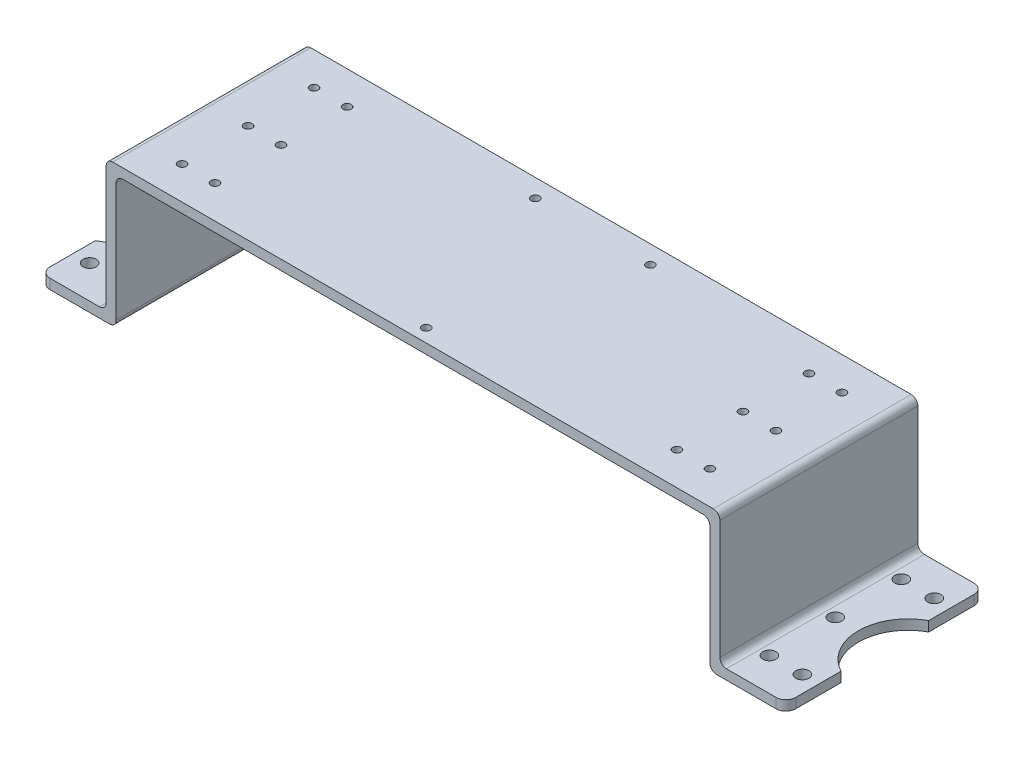
from build123d import *

# Parameters (mm, degrees)
SKETCH_1_W                  = 186
SKETCH_1_H                  = 60
EXTRUDE_1_DEPTH             = 3
SKETCH_2_W                  = 3
SKETCH_2_H                  = 60
EXTRUDE_2_DEPTH             = 40
SKETCH_3_W                  = 60
SKETCH_3_H                  = 3
EXTRUDE_3_DEPTH             = 20
SKETCH_4_R                  = 2
CUT_EXTRUDE_1_DEPTH         = 124.567795157
PATTERN_LINEAR_1_COUNT      = 3
PATTERN_LINEAR_1_PITCH      = 20
PATTERN_LINEAR_1_COUNT_DIR2 = 2
PATTERN_LINEAR_1_PITCH_DIR2 = 10
MIRROR_4_COPY_1_SKETCH_R    = 2
MIRROR_4_COPY_1_DEPTH       = 124.567795157
MIRROR_4_COPY_2_SKETCH_R    = 2
MIRROR_4_COPY_2_DEPTH       = 124.567795157
MIRROR_4_COPY_3_SKETCH_R    = 2
MIRROR_4_COPY_3_DEPTH       = 124.567795157
MIRROR_4_COPY_4_SKETCH_R    = 2
MIRROR_4_COPY_4_DEPTH       = 124.567795157
MIRROR_4_COPY_5_SKETCH_R    = 2
MIRROR_4_COPY_5_DEPTH       = 124.567795157
MIRROR_4_COPY_6_SKETCH_R    = 2
MIRROR_4_COPY_6_DEPTH       = 124.567795157
SKETCH_5_R                  = 1
CUT_EXTRUDE_2_DEPTH         = 3
SKETCH_6_R                  = 1
CUT_EXTRUDE_3_DEPTH         = 3
SKETCH_7_R                  = 1
CUT_EXTRUDE_4_DEPTH         = 3
PATTERN_LINEAR_2_COUNT      = 3
PATTERN_LINEAR_2_PITCH      = 20
PATTERN_LINEAR_2_COUNT_DIR2 = 2
PATTERN_LINEAR_2_PITCH_DIR2 = 10
MIRROR_6_COPY_1_SKETCH_R    = 1
MIRROR_6_COPY_1_DEPTH       = 3
MIRROR_6_COPY_2_SKETCH_R    = 1
MIRROR_6_COPY_2_DEPTH       = 3
MIRROR_6_COPY_3_SKETCH_R    = 1
MIRROR_6_COPY_3_DEPTH       = 3
MIRROR_6_COPY_4_SKETCH_R    = 1
MIRROR_6_COPY_4_DEPTH       = 3
MIRROR_6_COPY_5_SKETCH_R    = 1
MIRROR_6_COPY_5_DEPTH       = 3
MIRROR_6_COPY_6_SKETCH_R    = 1
MIRROR_6_COPY_6_DEPTH       = 3
HOLE_WIZARD_M3_1_D          = 2.5
HOLE_WIZARD_M3_2_D          = 2.5
SKETCH_12_R                 = 15
CUT_EXTRUDE_5_DEPTH         = 124.567795157
FILLET_2_R                  = 2
FILLET_3_R                  = 2
FILLET_4_R                  = 2
FILLET_5_R                  = 3


with BuildPart() as part:
    # 草图1 → 凸台-拉伸1 (new body)
    with BuildSketch(Plane(origin=(0, 0, 0), x_dir=(1, 0, 0), z_dir=(0, 1, 0))):
        Rectangle(SKETCH_1_W, SKETCH_1_H)
    extrude(amount=EXTRUDE_1_DEPTH)

    # 草图2 → 凸台-拉伸2 (add)
    with BuildSketch(Plane.XZ):
        with Locations((-91.5, 0)):
            Rectangle(SKETCH_2_W, SKETCH_2_H)
    extrude_2 = extrude(amount=EXTRUDE_2_DEPTH)

    # 草图3 → 凸台-拉伸3 (add)
    with BuildSketch(Plane.ZY.offset(93)):
        with Locations((0, -38.5)):
            Rectangle(SKETCH_3_W, SKETCH_3_H)
    extrude_3 = extrude(amount=EXTRUDE_3_DEPTH)

    # 草图4 → 切除-拉伸1 (cut, through all)
    with BuildSketch(Plane(origin=(0, -37, 0), x_dir=(1, 0, 0), z_dir=(0, 1, 0))):
        with Locations((-98, -20)):
            Circle(SKETCH_4_R)
    cut_extrude_1 = extrude(amount=-CUT_EXTRUDE_1_DEPTH, mode=Mode.SUBTRACT)

    # 阵列(线性)1: Cut-Extrude 1 3 × 2
    with Locations(*[(-j * PATTERN_LINEAR_1_PITCH_DIR2, 0, -i * PATTERN_LINEAR_1_PITCH) for i in range(PATTERN_LINEAR_1_COUNT) for j in range(PATTERN_LINEAR_1_COUNT_DIR2) if (i, j) != (0, 0)]):
        add(cut_extrude_1, mode=Mode.SUBTRACT)

    # 镜向4: 凸台-拉伸2, 凸台-拉伸3 across plane
    add(extrude_2.mirror(Plane(origin=(0, 0, 0), x_dir=(0, 0, 1), z_dir=(1, 0, 0))))
    add(extrude_3.mirror(Plane(origin=(0, 0, 0), x_dir=(0, 0, 1), z_dir=(1, 0, 0))))

    # 镜向4 copy 1 sketch → 镜向4 copy 1 (cut, through all)
    with BuildSketch(Plane(origin=(10, -37, 0), x_dir=(-1, 0, 0), z_dir=(0, 1, 0))):
        with Locations((-98, 20)):
            Circle(MIRROR_4_COPY_1_SKETCH_R)
    extrude(amount=-MIRROR_4_COPY_1_DEPTH, mode=Mode.SUBTRACT)

    # 镜向4 copy 2 sketch → 镜向4 copy 2 (cut, through all)
    with BuildSketch(Plane(origin=(0, -37, -20), x_dir=(-1, 0, 0), z_dir=(0, 1, 0))):
        with Locations((-98, 20)):
            Circle(MIRROR_4_COPY_2_SKETCH_R)
    extrude(amount=-MIRROR_4_COPY_2_DEPTH, mode=Mode.SUBTRACT)

    # 镜向4 copy 3 sketch → 镜向4 copy 3 (cut, through all)
    with BuildSketch(Plane(origin=(10, -37, -20), x_dir=(-1, 0, 0), z_dir=(0, 1, 0))):
        with Locations((-98, 20)):
            Circle(MIRROR_4_COPY_3_SKETCH_R)
    extrude(amount=-MIRROR_4_COPY_3_DEPTH, mode=Mode.SUBTRACT)

    # 镜向4 copy 4 sketch → 镜向4 copy 4 (cut, through all)
    with BuildSketch(Plane(origin=(0, -37, -40), x_dir=(-1, 0, 0), z_dir=(0, 1, 0))):
        with Locations((-98, 20)):
            Circle(MIRROR_4_COPY_4_SKETCH_R)
    extrude(amount=-MIRROR_4_COPY_4_DEPTH, mode=Mode.SUBTRACT)

    # 镜向4 copy 5 sketch → 镜向4 copy 5 (cut, through all)
    with BuildSketch(Plane(origin=(10, -37, -40), x_dir=(-1, 0, 0), z_dir=(0, 1, 0))):
        with Locations((-98, 20)):
            Circle(MIRROR_4_COPY_5_SKETCH_R)
    extrude(amount=-MIRROR_4_COPY_5_DEPTH, mode=Mode.SUBTRACT)

    # 镜向4 copy 6 sketch → 镜向4 copy 6 (cut, through all)
    with BuildSketch(Plane(origin=(0, -37, 0), x_dir=(-1, 0, 0), z_dir=(0, 1, 0))):
        with Locations((-98, 20)):
            Circle(MIRROR_4_COPY_6_SKETCH_R)
    extrude(amount=-MIRROR_4_COPY_6_DEPTH, mode=Mode.SUBTRACT)

    # 草图5 → 切除-拉伸2 (cut)
    with BuildSketch(Plane(origin=(0, 3, 0), x_dir=(1, 0, 0), z_dir=(0, 1, 0))):
        with Locations((0, -26)):
            Circle(SKETCH_5_R)
    extrude(amount=-CUT_EXTRUDE_2_DEPTH, mode=Mode.SUBTRACT)

    # 草图6 → 切除-拉伸3 (cut)
    with BuildSketch(Plane(origin=(0, 3, 0), x_dir=(1, 0, 0), z_dir=(0, 1, 0))):
        with Locations((-17.45, 24.5)):
            Circle(SKETCH_6_R)
    cut_extrude_3 = extrude(amount=-CUT_EXTRUDE_3_DEPTH, mode=Mode.SUBTRACT)

    # 镜向5: 切除-拉伸3 across plane
    add(cut_extrude_3.mirror(Plane(origin=(0, 0, 0), x_dir=(0, 0, 1), z_dir=(1, 0, 0))), mode=Mode.SUBTRACT)

    # 草图7 → 切除-拉伸4 (cut)
    with BuildSketch(Plane(origin=(0, 3, 0), x_dir=(1, 0, 0), z_dir=(0, 1, 0))):
        with Locations((-70, -20)):
            Circle(SKETCH_7_R)
    cut_extrude_4 = extrude(amount=-CUT_EXTRUDE_4_DEPTH, mode=Mode.SUBTRACT)

    # 阵列(线性)2: Cut-Extrude 4 3 × 2
    with Locations(*[(-j * PATTERN_LINEAR_2_PITCH_DIR2, 0, -i * PATTERN_LINEAR_2_PITCH) for i in range(PATTERN_LINEAR_2_COUNT) for j in range(PATTERN_LINEAR_2_COUNT_DIR2) if (i, j) != (0, 0)]):
        add(cut_extrude_4, mode=Mode.SUBTRACT)

    # 镜向6 copy 1 sketch → 镜向6 copy 1 (cut)
    with BuildSketch(Plane(origin=(10, 3, 0), x_dir=(-1, 0, 0), z_dir=(0, 1, 0))):
        with Locations((-70, 20)):
            Circle(MIRROR_6_COPY_1_SKETCH_R)
    extrude(amount=-MIRROR_6_COPY_1_DEPTH, mode=Mode.SUBTRACT)

    # 镜向6 copy 2 sketch → 镜向6 copy 2 (cut)
    with BuildSketch(Plane(origin=(0, 3, -20), x_dir=(-1, 0, 0), z_dir=(0, 1, 0))):
        with Locations((-70, 20)):
            Circle(MIRROR_6_COPY_2_SKETCH_R)
    extrude(amount=-MIRROR_6_COPY_2_DEPTH, mode=Mode.SUBTRACT)

    # 镜向6 copy 3 sketch → 镜向6 copy 3 (cut)
    with BuildSketch(Plane(origin=(10, 3, -20), x_dir=(-1, 0, 0), z_dir=(0, 1, 0))):
        with Locations((-70, 20)):
            Circle(MIRROR_6_COPY_3_SKETCH_R)
    extrude(amount=-MIRROR_6_COPY_3_DEPTH, mode=Mode.SUBTRACT)

    # 镜向6 copy 4 sketch → 镜向6 copy 4 (cut)
    with BuildSketch(Plane(origin=(0, 3, -40), x_dir=(-1, 0, 0), z_dir=(0, 1, 0))):
        with Locations((-70, 20)):
            Circle(MIRROR_6_COPY_4_SKETCH_R)
    extrude(amount=-MIRROR_6_COPY_4_DEPTH, mode=Mode.SUBTRACT)

    # 镜向6 copy 5 sketch → 镜向6 copy 5 (cut)
    with BuildSketch(Plane(origin=(10, 3, -40), x_dir=(-1, 0, 0), z_dir=(0, 1, 0))):
        with Locations((-70, 20)):
            Circle(MIRROR_6_COPY_5_SKETCH_R)
    extrude(amount=-MIRROR_6_COPY_5_DEPTH, mode=Mode.SUBTRACT)

    # 镜向6 copy 6 sketch → 镜向6 copy 6 (cut)
    with BuildSketch(Plane(origin=(0, 3, 0), x_dir=(-1, 0, 0), z_dir=(0, 1, 0))):
        with Locations((-70, 20)):
            Circle(MIRROR_6_COPY_6_SKETCH_R)
    extrude(amount=-MIRROR_6_COPY_6_DEPTH, mode=Mode.SUBTRACT)

    # M3 螺纹孔1 (through all)
    with Locations(Plane(origin=(0, 3, 0), x_dir=(1, 0, 0), z_dir=(0, 1, 0))):
        with Locations((-80, -20), (-70, -20), (-70, 0), (-80, 0), (-70, 20), (-80, 20), (70, -20), (80, -20), (70, 0), (80, 0), (70, 20), (80, 20)):
            Hole(HOLE_WIZARD_M3_1_D / 2)

    # M3 螺纹孔2 (through all)
    with Locations(Plane(origin=(0, 3, 0), x_dir=(1, 0, 0), z_dir=(0, 1, 0))):
        with Locations((-17.45, 24.5), (17.45, 24.5), (0, -26)):
            Hole(HOLE_WIZARD_M3_2_D / 2)

    # 草图12 → 切除-拉伸5 (cut, through all)
    with BuildSketch(Plane(origin=(0, -37, 0), x_dir=(1, 0, 0), z_dir=(0, 1, 0))):
        with Locations((-120, 0)):
            Circle(SKETCH_12_R)
    cut_extrude_5 = extrude(amount=-CUT_EXTRUDE_5_DEPTH, mode=Mode.SUBTRACT)

    # 镜向7: 切除-拉伸5 across plane
    add(cut_extrude_5.mirror(Plane(origin=(0, 0, 0), x_dir=(0, 0, 1), z_dir=(1, 0, 0))), mode=Mode.SUBTRACT)

    # 圆角2
    fillet_2_edges = [part.edges().sort_by_distance(p)[0] for p in [
        (-90, 0, 0),
        (-93, 3, 0),
    ]]
    fillet(fillet_2_edges, radius=FILLET_2_R)

    # 圆角3
    fillet_3_edges = [part.edges().sort_by_distance(p)[0] for p in [
        (90, 0, 0),
        (93, 3, 0),
    ]]
    fillet(fillet_3_edges, radius=FILLET_3_R)

    # 圆角4
    fillet_4_edges = [part.edges().sort_by_distance(p)[0] for p in [
        (-90, -40, 0),
        (-93, -37, 0),
        (93, -37, 0),
        (90, -40, 0),
    ]]
    fillet(fillet_4_edges, radius=FILLET_4_R)

    # 圆角5
    fillet_5_edges = [part.edges().sort_by_distance(p)[0] for p in [
        (-113, -38.5, 30),
        (-113, -38.5, -30),
        (113, -38.5, -30),
        (113, -38.5, 30),
    ]]
    fillet(fillet_5_edges, radius=FILLET_5_R)


solid = part.part
